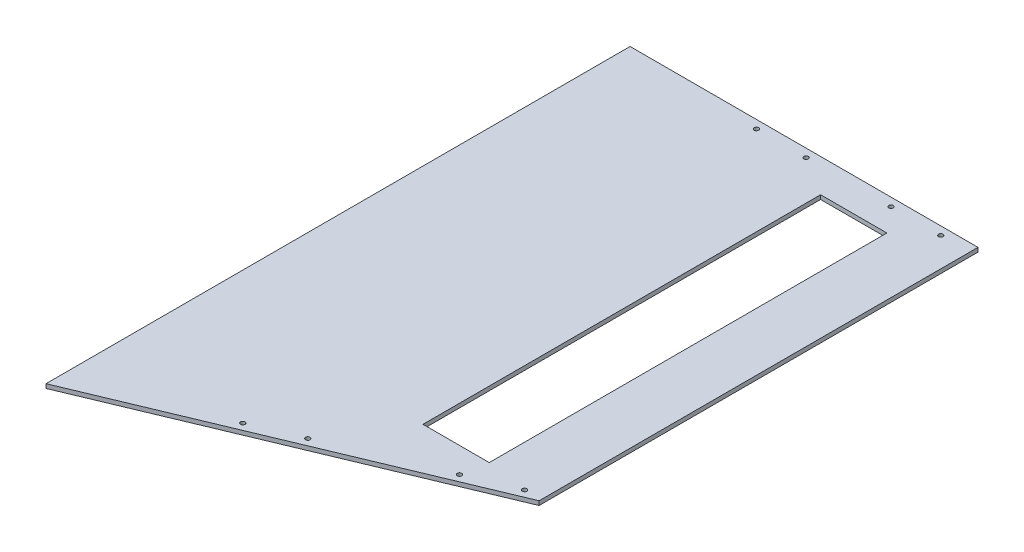
from build123d import *

# Parameters (mm, degrees)
SKETCH1_W               = 381
SKETCH1_H               = 6.35
BASE_FLANGE1_DEPTH      = 831.85
CUT_EXTRUDE1_DEPTH      = 915.973084304
CUT_EXTRUDE1_DEPTH_BACK = 6.35
SKETCH9_R               = 3.429
CUT_EXTRUDE2_DEPTH      = 6.35
SKETCH10_R              = 3.429
CUT_EXTRUDE3_DEPTH      = 6.35
SKETCH11_W              = 101.6
SKETCH11_H              = 609.6
CUT_EXTRUDE4_DEPTH      = 6.35
BOSS_EXTRUDE1_START     = -6.35
BOSS_EXTRUDE1_DEPTH     = 6.35


# Sheet-metal steps are written as plain solids
with BuildPart() as part:
    # Sketch1 → Base-Flange1 (new body)
    with BuildSketch(Plane.XY):
        with Locations((190.5, -3.175)):
            Rectangle(SKETCH1_W, SKETCH1_H)
    extrude(amount=BASE_FLANGE1_DEPTH)

    # Sketch8 → Cut-Extrude1 (cut, two sides: drawn at the far end of the back side and taken through both)
    with BuildSketch(Plane(origin=(0, 0, 0), x_dir=(1, 0, 0), z_dir=(0, 1, 0)).offset(-CUT_EXTRUDE1_DEPTH_BACK)):
        Polygon((381, -672.879100114), (0, -831.85), (381, -831.85), align=None)
    extrude(amount=CUT_EXTRUDE1_DEPTH + CUT_EXTRUDE1_DEPTH_BACK, mode=Mode.SUBTRACT)

    # Sketch9 → Cut-Extrude2 (cut)
    with BuildSketch(Plane(origin=(0, 0, 0), x_dir=(1, 0, 0), z_dir=(0, 1, 0))):
        with Locations(Location((130.175, -12.7, 0), (0, 0, 270))):
            Circle(SKETCH9_R)
        with Locations(Location((53.975, -12.7, 0), (0, 0, 270))):
            Circle(SKETCH9_R)
    extrude(amount=-CUT_EXTRUDE2_DEPTH, mode=Mode.SUBTRACT)

    # Sketch10 → Cut-Extrude3 (cut)
    with BuildSketch(Plane(origin=(0, 0, 0), x_dir=(1, 0, 0), z_dir=(0, 1, 0))):
        with Locations(Location((50.8, -796.892712954, 0), (0, 0, 270))):
            Circle(SKETCH10_R)
        with Locations(Location((121.123977295, -767.550282628, 0), (0, 0, 270))):
            Circle(SKETCH10_R)
        with Locations(Location((285.21325765, -699.084611868, 0), (0, 0, 270))):
            Circle(SKETCH10_R)
        with Locations(Location((355.537234945, -669.742181542, 0), (0, 0, 270))):
            Circle(SKETCH10_R)
        with Locations(Location((260.35, -12.7, 0), (0, 0, 270))):
            Circle(SKETCH10_R)
        with Locations(Location((336.55, -12.7, 0), (0, 0, 270))):
            Circle(SKETCH10_R)
    extrude(amount=-CUT_EXTRUDE3_DEPTH, mode=Mode.SUBTRACT)

    # Sketch11 → Cut-Extrude4 (cut)
    with BuildSketch(Plane(origin=(0, 0, 0), x_dir=(1, 0, 0), z_dir=(0, 1, 0))):
        with Locations((241.3, -355.6)):
            Rectangle(SKETCH11_W, SKETCH11_H)
    extrude(amount=-CUT_EXTRUDE4_DEPTH, mode=Mode.SUBTRACT)

    # Sketch12 → Boss-Extrude1 (add)
    with BuildSketch(Plane(origin=(0, 0, 0), x_dir=(1, 0, 0), z_dir=(0, 1, 0)).offset(BOSS_EXTRUDE1_START)):
        Polygon((0, -831.85), (-152.4, -895.438359954), (-152.4, 0), (0, 0), align=None)
    extrude(amount=BOSS_EXTRUDE1_DEPTH)


solid = part.part
